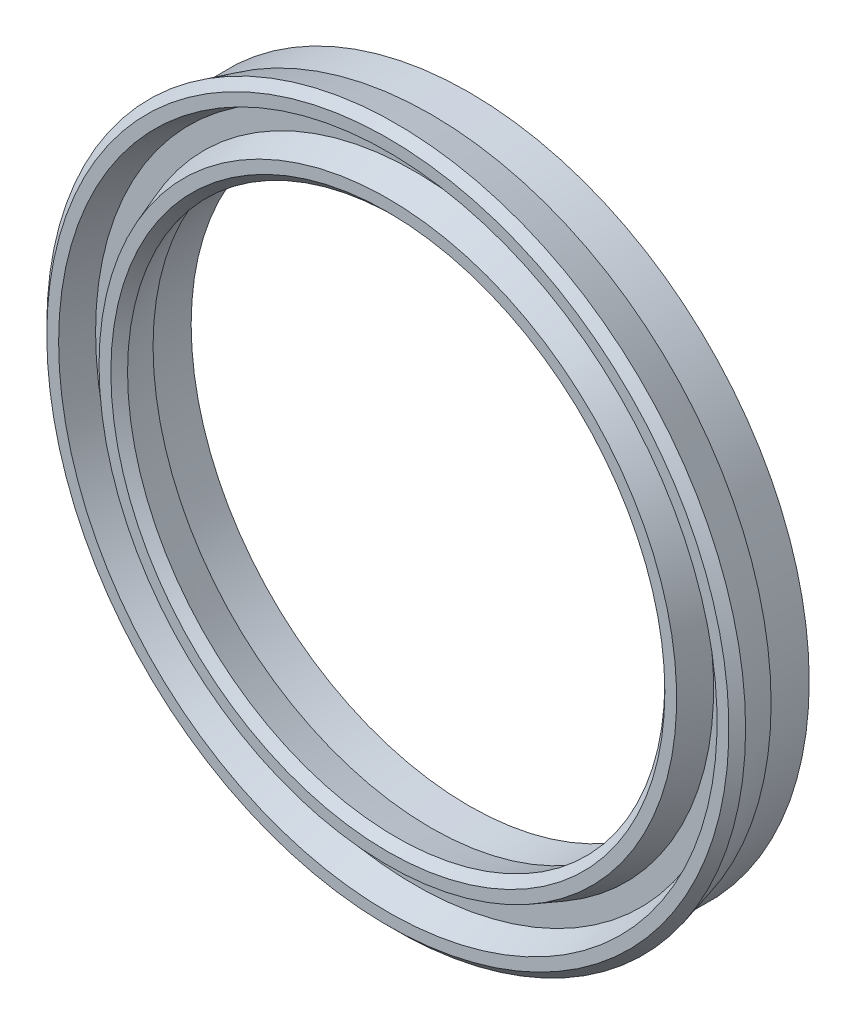
from build123d import *


with BuildPart() as part:
    # Sketch1 → Body (revolve)
    with BuildSketch(Plane(origin=(-63.6, 0, -73.557122905), x_dir=(-1, 0, 0), z_dir=(0, 1, 0))):
        Polygon((-114.2, 58.757122905), (-125.5, 58.757122905), (-125.5, 65.692025334), (-127.2, 72.036511707), (-125.679388802, 73.557122905), (-123.528919822, 73.557122905), (-121.733333333, 68.623789572), (-117.966666667, 68.623789572), (-116.171080178, 73.557122905), (-114.020611198, 73.557122905), (-112.5, 72.036511707), (-114.2, 65.692025334), align=None)
    revolve(axis=Axis((0, 0, -14.8), (0, 0, 1)))


solid = part.part
